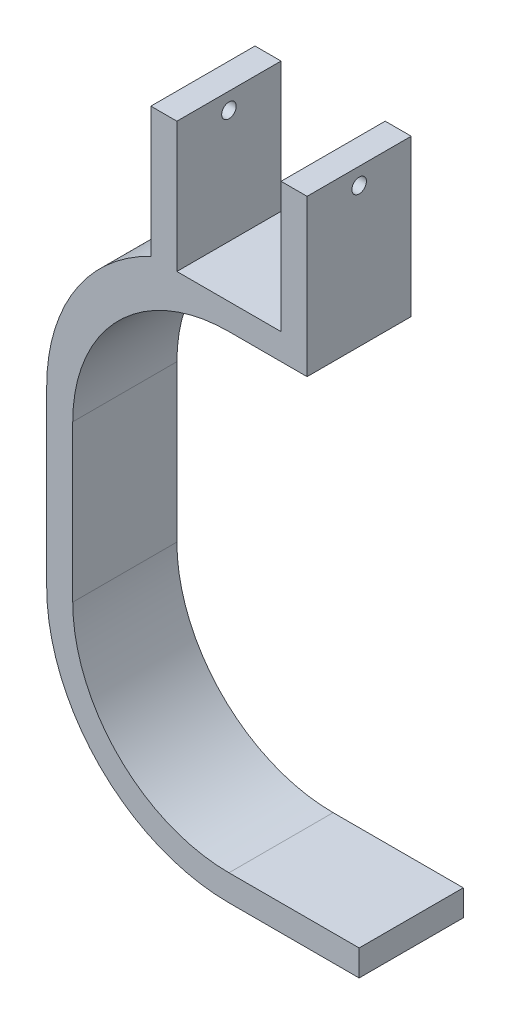
from build123d import *

# Parameters (mm, degrees)
BOSS_EXTRUDE1_DEPTH = 20
FILLET1_R           = 30
FILLET2_R           = 35
SKETCH2_W           = 5
SKETCH2_H           = 20
BOSS_EXTRUDE2_DEPTH = 15
SKETCH3_R           = 1.4
CUT_EXTRUDE1_DEPTH  = 45


with BuildPart() as part:
    # Sketch1 → Boss-Extrude1 (new body)
    with BuildSketch(Plane.XY):
        Polygon((11.448507825, 54.464802922), (6.448507825, 54.464802922), (6.448507825, 44.464802922), (-8.551492175, 44.464802922), (-13.551492175, 44.464802922), (-13.551492175, 39.464802922), (-13.551492175, -50.535197078), (-13.551492175, -55.535197078), (-8.551492175, -55.535197078), (46.448507825, -55.535197078), (46.448507825, -50.535197078), (-8.551492175, -50.535197078), (-8.551492175, 39.464802922), (6.448507825, 39.464802922), (36.448507825, 39.464802922), (36.448507825, 54.464802922), (31.448507825, 54.464802922), (31.448507825, 44.464802922), (11.448507825, 44.464802922), align=None)
    extrude(amount=BOSS_EXTRUDE1_DEPTH)

    # Fillet1
    fillet1_edges = [part.edges().sort_by_distance(p)[0] for p in [
        (-8.551492175, 39.464802922, 10),
        (-8.551492175, -50.535197078, 10),
    ]]
    fillet(fillet1_edges, radius=FILLET1_R)

    # Fillet2
    # the kernel refuses this fillet: 35 mm, written as the material it takes off along each edge
    with BuildSketch(Plane(origin=(-13.551492175, -55.535197078, -87.5), x_dir=(1, 0, 0), z_dir=(0, 0, 1))) as fillet2_piece_1:
        with BuildLine():
            CenterArc((FILLET2_R, FILLET2_R), FILLET2_R, 180, 90)
            Line((0, FILLET2_R), (-FILLET2_R * 0.02, FILLET2_R))
            Line((-FILLET2_R * 0.02, FILLET2_R), (-FILLET2_R * 0.02, -FILLET2_R * 0.02))
            Line((-FILLET2_R * 0.02, -FILLET2_R * 0.02), (FILLET2_R, -FILLET2_R * 0.02))
            Line((FILLET2_R, -FILLET2_R * 0.02), (FILLET2_R, 0))
        make_face()
    extrude(amount=195, mode=Mode.SUBTRACT)
    with BuildSketch(Plane(origin=(-13.551492175, 44.464802922, -79.056941504), x_dir=(0, -1, 0), z_dir=(0, 0, 1))) as fillet2_piece_2:
        with BuildLine():
            CenterArc((31.622776602, 35), FILLET2_R, 205.376933525, 64.623066475)
            Line((0, 20), (-0.632455532, 19.7))
            ThreePointArc((-0.632455532, 19.7), (-0.7, 10), (-0.7, 0))
            Line((-0.7, 0), (0, -0.7))
            Line((0, -0.7), (31.622776602, -0.7))
            Line((31.622776602, -0.7), (31.622776602, 0))
        make_face()
    extrude(amount=178.113883008, mode=Mode.SUBTRACT)

    # Sketch2 → Boss-Extrude2 (add)
    with BuildSketch(Plane(origin=(0, 54.464802922, 0), x_dir=(1, 0, 0), z_dir=(0, 1, 0))):
        with Locations((8.948507825, -10)):
            Rectangle(SKETCH2_W, SKETCH2_H)
        with Locations((33.948507825, -10)):
            Rectangle(SKETCH2_W, SKETCH2_H)
    extrude(amount=BOSS_EXTRUDE2_DEPTH)

    # Sketch3 → Cut-Extrude1 (cut)
    with BuildSketch(Plane(origin=(36.448507825, 0, 0), x_dir=(0, 0, -1), z_dir=(1, 0, 0))):
        with Locations(Location((-10, 66.264802922, 0), (0, 0, 90))):
            Circle(SKETCH3_R)
    extrude(amount=-CUT_EXTRUDE1_DEPTH, mode=Mode.SUBTRACT)


solid = part.part
